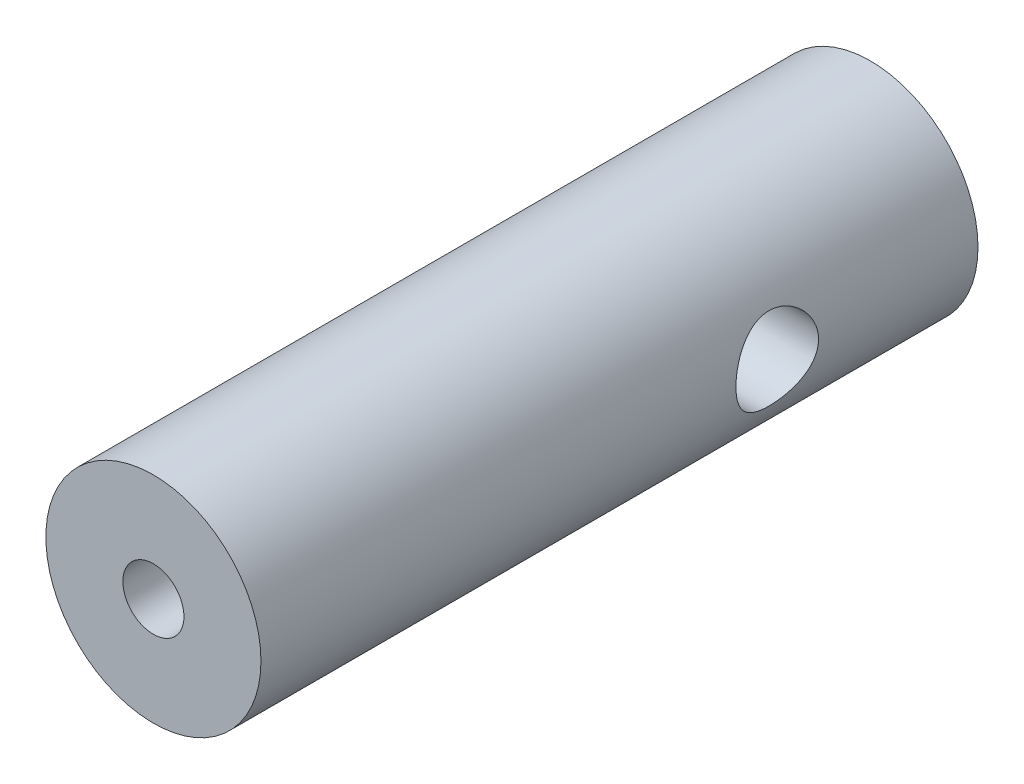
from build123d import *

# Parameters (mm, degrees)
SKETCH1_R                 = 4.7625
BOSS_EXTRUDE1_DEPTH       = 31.75
CUT_EXTRUDE2_DEPTH        = 33.456514177
CUT_EXTRUDE2_DEPTH_BACK   = 33.456514177
SKETCH3_R                 = 1.8288
F_6_32_TAPPED_HOLE1_D     = 2.7051
F_6_32_TAPPED_HOLE1_DEPTH = 12.7
F_6_32_TAPPED_HOLE1_TIP   = 0.81269403


with BuildPart() as part:
    # Sketch1 → Boss-Extrude1 (new body)
    with BuildSketch(Plane.XY):
        Circle(SKETCH1_R)
    extrude(amount=BOSS_EXTRUDE1_DEPTH)

    # Sketch3 → Cut-Extrude2 (cut, two sides: drawn at the far end of the back side and taken through both)
    with BuildSketch(Plane(origin=(0, 0, 0), x_dir=(0, 0, -1), z_dir=(1, 0, 0)).offset(-CUT_EXTRUDE2_DEPTH_BACK)):
        with Locations((-8.89, 0)):
            Circle(SKETCH3_R)
    extrude(amount=CUT_EXTRUDE2_DEPTH + CUT_EXTRUDE2_DEPTH_BACK, mode=Mode.SUBTRACT)

    # #6-32 Tapped Hole1
    with Locations(Plane.XY.offset(31.75)):
        with Locations((0, 0)):
            Hole(F_6_32_TAPPED_HOLE1_D / 2, depth=F_6_32_TAPPED_HOLE1_DEPTH)
            with Locations((0, 0, -(F_6_32_TAPPED_HOLE1_DEPTH + F_6_32_TAPPED_HOLE1_TIP / 2))):  # 118° drill point
                Cone(0, F_6_32_TAPPED_HOLE1_D / 2, F_6_32_TAPPED_HOLE1_TIP, mode=Mode.SUBTRACT)


solid = part.part
